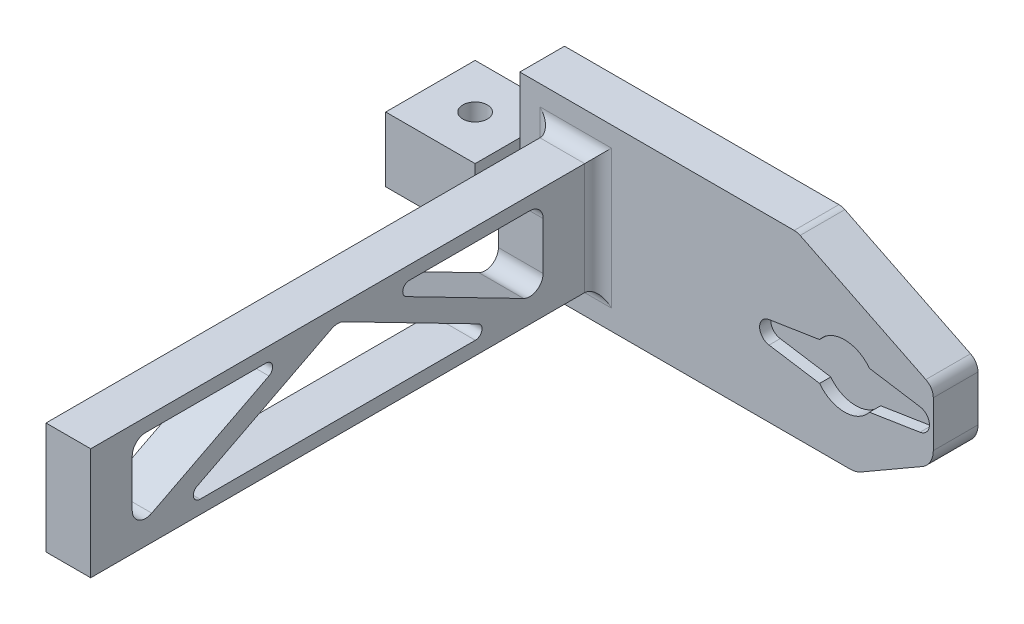
from build123d import *

# Parameters (mm, degrees)
SKETCH3_W            = 42.5
SKETCH3_H            = 15
BOSS_EXTRUDE1_DEPTH  = 10
SKETCH2_R            = 7.012606221
CUT_EXTRUDE1_DEPTH   = 2.5
SKETCH11_W           = 42.5
SKETCH11_H           = 10
BOSS_EXTRUDE5_DEPTH  = 10
SKETCH14_W           = 42.5
SKETCH14_H           = 10
BOSS_EXTRUDE7_DEPTH  = 15
SKETCH20_W           = 10
SKETCH20_H           = 40
BOSS_EXTRUDE10_DEPTH = 50
SKETCH21_W           = 10
SKETCH21_H           = 25
BOSS_EXTRUDE11_DEPTH = 113.5
FILLET1_R            = 3
CHAMFER1_SIZE        = 15
CHAMFER1_SIZE2       = 30.41699103
FILLET2_R            = 3
CHAMFER2_SIZE        = 10
CHAMFER2_SIZE2       = 17.320508076
FILLET3_R            = 5
CUT_EXTRUDE2_DEPTH   = 144.583262507
FILLET4_R            = 3
FILLET5_R            = 1.5
SKETCH25_W           = 10
SKETCH25_H           = 14.5
BOSS_EXTRUDE12_DEPTH = 20
SKETCH26_W           = 20
SKETCH26_H           = 14.5
BOSS_EXTRUDE13_DEPTH = 10
M5_CLEARANCE_HOLE1_D = 5.5


with BuildPart() as part:
    # Sketch3 → Boss-Extrude1 (new body)
    with BuildSketch(Plane.XY):
        with Locations((-1.388845539, 0.05888455)):
            Rectangle(SKETCH3_W, SKETCH3_H)
    extrude(amount=-BOSS_EXTRUDE1_DEPTH)

    # Sketch2 → Cut-Extrude1 (cut)
    with BuildSketch(Plane.XY):
        Circle(SKETCH2_R)
        with BuildLine():
            Line((-16.888114198, 2.469689731), (-3.968626967, 4.5))
            ThreePointArc((-3.968626967, 4.5), (0, 6), (3.968626967, 4.5))
            Line((3.968626967, 4.5), (16.888114198, 2.469689731))
            ThreePointArc((16.888114198, 2.469689731), (19, 0), (16.888114198, -2.469689731))
            Line((16.888114198, -2.469689731), (3.968626967, -4.5))
            ThreePointArc((3.968626967, -4.5), (0, -6), (-3.968626967, -4.5))
            Line((-3.968626967, -4.5), (-16.888114198, -2.469689731))
            ThreePointArc((-16.888114198, -2.469689731), (-19, 0), (-16.888114198, 2.469689731))
        make_face()
    extrude(amount=-CUT_EXTRUDE1_DEPTH, mode=Mode.SUBTRACT)

    # Sketch11 → Boss-Extrude5 (add)
    with BuildSketch(Plane.XZ.offset(7.44111545)):
        with Locations((-1.388845539, -5)):
            Rectangle(SKETCH11_W, SKETCH11_H)
    extrude(amount=BOSS_EXTRUDE5_DEPTH)

    # Sketch14 → Boss-Extrude7 (add)
    with BuildSketch(Plane(origin=(0, 7.55888455, 0), x_dir=(1, 0, 0), z_dir=(0, 1, 0))):
        with Locations((-1.388845539, 5)):
            Rectangle(SKETCH14_W, SKETCH14_H)
    extrude(amount=BOSS_EXTRUDE7_DEPTH)

    # Sketch20 → Boss-Extrude10 (add)
    with BuildSketch(Plane.ZY.offset(22.638845539)):
        with Locations((-5, 2.55888455)):
            Rectangle(SKETCH20_W, SKETCH20_H)
    extrude(amount=BOSS_EXTRUDE10_DEPTH)

    # Sketch21 → Boss-Extrude11 (add)
    with BuildSketch(Plane.XY):
        with Locations((-60.138845539, 2.55888455)):
            Rectangle(SKETCH21_W, SKETCH21_H)
    extrude(amount=BOSS_EXTRUDE11_DEPTH)

    # Fillet1
    fillet1_edges = [part.edges().sort_by_distance(p)[0] for p in [
        (-60.138845539, 15.05888455, 0),
        (-65.138845539, 2.55888455, 0),
        (-55.138845539, 2.55888455, 0),
        (-60.138845539, -9.94111545, 0),
    ]]
    fillet(fillet1_edges, radius=FILLET1_R)

    # Chamfer1
    chamfer1_edges = [part.edges().sort_by_distance(p)[0] for p in [
        (19.861154461, 22.55888455, -5),
    ]]
    chamfer1_side = [part.faces().sort_by_distance(p)[0] for p in [
        (19.861154461, 2.55888455, -5),
    ]]
    chamfer(chamfer1_edges, length=CHAMFER1_SIZE, length2=CHAMFER1_SIZE2, reference=chamfer1_side[0])

    # Fillet2
    fillet2_edges = [part.edges().sort_by_distance(p)[0] for p in [
        (-10.555836569, 22.55888455, -5),
        (19.861154461, 7.55888455, -5),
    ]]
    fillet(fillet2_edges, radius=FILLET2_R)

    # Chamfer2
    chamfer2_edges = [part.edges().sort_by_distance(p)[0] for p in [
        (19.861154461, -17.44111545, -5),
    ]]
    chamfer2_side = [part.faces().sort_by_distance(p)[0] for p in [
        (19.861154461, -5.873875391, -5),
    ]]
    chamfer(chamfer2_edges, length=CHAMFER2_SIZE, length2=CHAMFER2_SIZE2, reference=chamfer2_side[0])

    # Fillet3
    fillet3_edges = [part.edges().sort_by_distance(p)[0] for p in [
        (2.540646385, -17.44111545, -5),
        (19.861154461, -7.44111545, -5),
    ]]
    fillet(fillet3_edges, radius=FILLET3_R)

    # Sketch24 → Cut-Extrude2 (cut, through all)
    with BuildSketch(Plane.ZY.offset(65.138845539)):
        Polygon((58.25, -6.94111545), (95.25, -6.94111545), (58.25, 12.05888455), (21.25, -6.94111545), align=None)
        Polygon((48.39896268, 12.05888455), (12.290027833, -6.483541453), (12.290027833, 12.05888455), align=None)
        Polygon((68.10103732, 12.05888455), (104.209972167, 12.05888455), (104.209972167, -6.483541453), align=None)
    extrude(amount=-CUT_EXTRUDE2_DEPTH, mode=Mode.SUBTRACT)

    # Fillet4
    fillet4_edges = [part.edges().sort_by_distance(p)[0] for p in [
        (-60.138845539, -6.483541453, 12.290027833),
        (-60.138845539, 12.05888455, 12.290027833),
        (-60.138845539, -6.483541453, 104.209972167),
        (-60.138845539, 12.05888455, 104.209972167),
        (-60.138845539, 12.05888455, 58.25),
    ]]
    fillet(fillet4_edges, radius=FILLET4_R)

    # Fillet5
    fillet5_edges = [part.edges().sort_by_distance(p)[0] for p in [
        (-60.138845539, 12.05888455, 68.10103732),
        (-60.138845539, -6.94111545, 95.25),
        (-60.138845539, -6.94111545, 21.25),
        (-60.138845539, 12.05888455, 48.39896268),
    ]]
    fillet(fillet5_edges, radius=FILLET5_R)

    # Sketch25 → Boss-Extrude12 (add)
    with BuildSketch(Plane.ZY.offset(72.638845539)):
        with Locations((-5, 2.55888455)):
            Rectangle(SKETCH25_W, SKETCH25_H)
    extrude(amount=BOSS_EXTRUDE12_DEPTH)

    # Sketch26 → Boss-Extrude13 (add)
    with BuildSketch(Plane.XY):
        with Locations((-82.638845539, 2.55888455)):
            Rectangle(SKETCH26_W, SKETCH26_H)
    extrude(amount=BOSS_EXTRUDE13_DEPTH)

    # M5 Clearance Hole1 (through all)
    with Locations(Plane(origin=(0, 9.80888455, 0), x_dir=(1, 0, 0), z_dir=(0, 1, 0))):
        with Locations((-82.638845539, 0)):
            Hole(M5_CLEARANCE_HOLE1_D / 2)


solid = part.part
